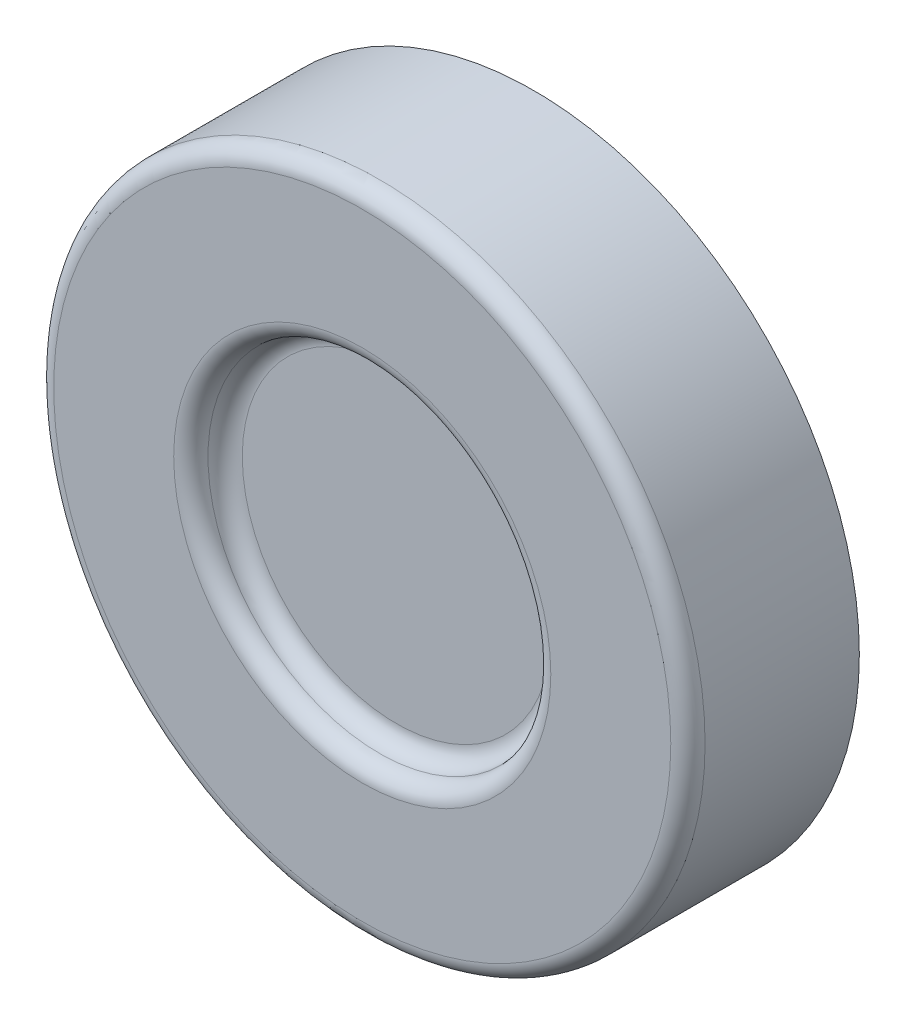
from build123d import *

# Parameters (mm, degrees)
SKETCH1_R           = 19
BOSS_EXTRUDE1_DEPTH = 10
SKETCH2_R           = 10
CUT_EXTRUDE1_DEPTH  = 2
FILLET1_R           = 1


with BuildPart() as part:
    # Sketch1 → Boss-Extrude1 (new body)
    with BuildSketch(Plane.XY):
        Circle(SKETCH1_R)
    extrude(amount=BOSS_EXTRUDE1_DEPTH)

    # Sketch2 → Cut-Extrude1 (cut)
    with BuildSketch(Plane.XY.offset(10)):
        Circle(SKETCH2_R)
    extrude(amount=-CUT_EXTRUDE1_DEPTH, mode=Mode.SUBTRACT)

    # Fillet1
    fillet1_edges = [part.edges().sort_by_distance(p)[0] for p in [
        (-19, 0, 10),
        (-10, 0, 8),
        (-10, 0, 10),
    ]]
    fillet(fillet1_edges, radius=FILLET1_R - 0.0001)  # a hair under: the kernel refuses the full size


solid = part.part
